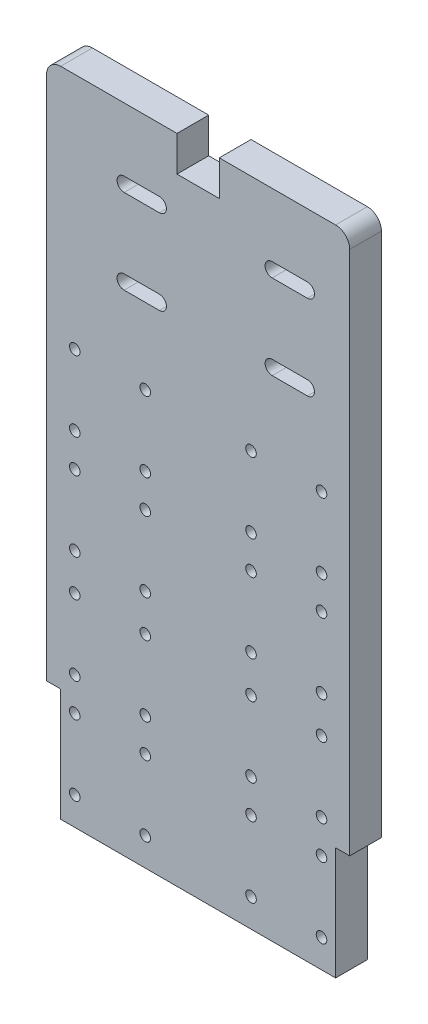
from build123d import *

# Parameters (mm, degrees)
ESQUISSE1_W             = 86
ESQUISSE1_H             = 185
BOSS_EXTRU_1_DEPTH      = 9
ESQUISSE2_R             = 1.5
ENL_V_MAT_EXTRU_1_DEPTH = 205.210675529
ESQUISSE3_R             = 1.5
ENL_V_MAT_EXTRU_2_DEPTH = 205.210675529
ESQUISSE4_W             = 4
ESQUISSE4_H             = 32
ENL_V_MAT_EXTRU_3_DEPTH = 205.210675529
ENL_V_MAT_EXTRU_4_DEPTH = 205.210675529
ESQUISSE7_W             = 12
ESQUISSE7_H             = 10
ENL_V_MAT_EXTRU_5_DEPTH = 205.210675529
CONG_1_R                = 4


with BuildPart() as part:
    # Esquisse1 → Boss.-Extru.1 (new body)
    with BuildSketch(Plane.XY):
        with Locations((43, 92.5)):
            Rectangle(ESQUISSE1_W, ESQUISSE1_H)
    extrude(amount=BOSS_EXTRU_1_DEPTH)

    # Esquisse2 → Enlèv. mat.-Extru.1 (cut, through all)
    with BuildSketch(Plane.XY.offset(9)):
        with Locations((8, 57.5)):
            Circle(ESQUISSE2_R)
        with Locations((28, 57.5)):
            Circle(ESQUISSE2_R)
        with Locations((28, 37.5)):
            Circle(ESQUISSE2_R)
        with Locations((8, 37.5)):
            Circle(ESQUISSE2_R)
        with Locations((78, 37.5)):
            Circle(ESQUISSE2_R)
        with Locations((58, 37.5)):
            Circle(ESQUISSE2_R)
        with Locations((58, 57.5)):
            Circle(ESQUISSE2_R)
        with Locations((78, 57.5)):
            Circle(ESQUISSE2_R)
        with Locations((78, 97.5)):
            Circle(ESQUISSE2_R)
        with Locations((58, 97.5)):
            Circle(ESQUISSE2_R)
        with Locations((58, 117.5)):
            Circle(ESQUISSE2_R)
        with Locations((78, 117.5)):
            Circle(ESQUISSE2_R)
        with Locations((8, 117.5)):
            Circle(ESQUISSE2_R)
        with Locations((28, 117.5)):
            Circle(ESQUISSE2_R)
        with Locations((28, 97.5)):
            Circle(ESQUISSE2_R)
        with Locations((8, 97.5)):
            Circle(ESQUISSE2_R)
    extrude(amount=-ENL_V_MAT_EXTRU_1_DEPTH, mode=Mode.SUBTRACT)

    # Esquisse3 → Enlèv. mat.-Extru.2 (cut, through all)
    with BuildSketch(Plane.XY.offset(9)):
        with Locations((8, 28)):
            Circle(ESQUISSE3_R)
        with Locations((8, 8)):
            Circle(ESQUISSE3_R)
        with Locations((28, 8)):
            Circle(ESQUISSE3_R)
        with Locations((28, 28)):
            Circle(ESQUISSE3_R)
        with Locations((28, 68)):
            Circle(ESQUISSE3_R)
        with Locations((28, 88)):
            Circle(ESQUISSE3_R)
        with Locations((8, 88)):
            Circle(ESQUISSE3_R)
        with Locations((8, 68)):
            Circle(ESQUISSE3_R)
        with Locations((78, 68)):
            Circle(ESQUISSE3_R)
        with Locations((78, 88)):
            Circle(ESQUISSE3_R)
        with Locations((58, 88)):
            Circle(ESQUISSE3_R)
        with Locations((58, 68)):
            Circle(ESQUISSE3_R)
        with Locations((58, 28)):
            Circle(ESQUISSE3_R)
        with Locations((58, 8)):
            Circle(ESQUISSE3_R)
        with Locations((78, 8)):
            Circle(ESQUISSE3_R)
        with Locations((78, 28)):
            Circle(ESQUISSE3_R)
    extrude(amount=-ENL_V_MAT_EXTRU_2_DEPTH, mode=Mode.SUBTRACT)

    # Esquisse4 → Enlèv. mat.-Extru.3 (cut, through all)
    with BuildSketch(Plane.XY.offset(9)):
        with Locations((2, 16)):
            Rectangle(ESQUISSE4_W, ESQUISSE4_H)
        with Locations((84, 16)):
            Rectangle(ESQUISSE4_W, ESQUISSE4_H)
    extrude(amount=-ENL_V_MAT_EXTRU_3_DEPTH, mode=Mode.SUBTRACT)

    # Esquisse6 → Enlèv. mat.-Extru.4 (cut, through all)
    with BuildSketch(Plane.XY.offset(9)):
        with BuildLine():
            Line((22, 167), (32, 167))
            ThreePointArc((32, 167), (34, 165), (32, 163))
            Line((32, 163), (22, 163))
            ThreePointArc((22, 163), (20, 165), (22, 167))
        make_face()
        with BuildLine():
            Line((22, 139), (32, 139))
            ThreePointArc((32, 139), (34, 141), (32, 143))
            Line((32, 143), (22, 143))
            ThreePointArc((22, 143), (20, 141), (22, 139))
        make_face()
        with BuildLine():
            Line((74, 167), (64, 167))
            ThreePointArc((64, 167), (62, 165), (64, 163))
            Line((64, 163), (74, 163))
            ThreePointArc((74, 163), (76, 165), (74, 167))
        make_face()
        with BuildLine():
            Line((74, 139), (64, 139))
            ThreePointArc((64, 139), (62, 141), (64, 143))
            Line((64, 143), (74, 143))
            ThreePointArc((74, 143), (76, 141), (74, 139))
        make_face()
    extrude(amount=-ENL_V_MAT_EXTRU_4_DEPTH, mode=Mode.SUBTRACT)

    # Esquisse7 → Enlèv. mat.-Extru.5 (cut, through all)
    with BuildSketch(Plane.XY.offset(9)):
        with Locations((43, 180)):
            Rectangle(ESQUISSE7_W, ESQUISSE7_H)
    extrude(amount=-ENL_V_MAT_EXTRU_5_DEPTH, mode=Mode.SUBTRACT)

    # Congé1
    cong_1_edges = [part.edges().sort_by_distance(p)[0] for p in [
        (86, 185, 4.5),
        (0, 185, 4.5),
    ]]
    fillet(cong_1_edges, radius=CONG_1_R)


solid = part.part
